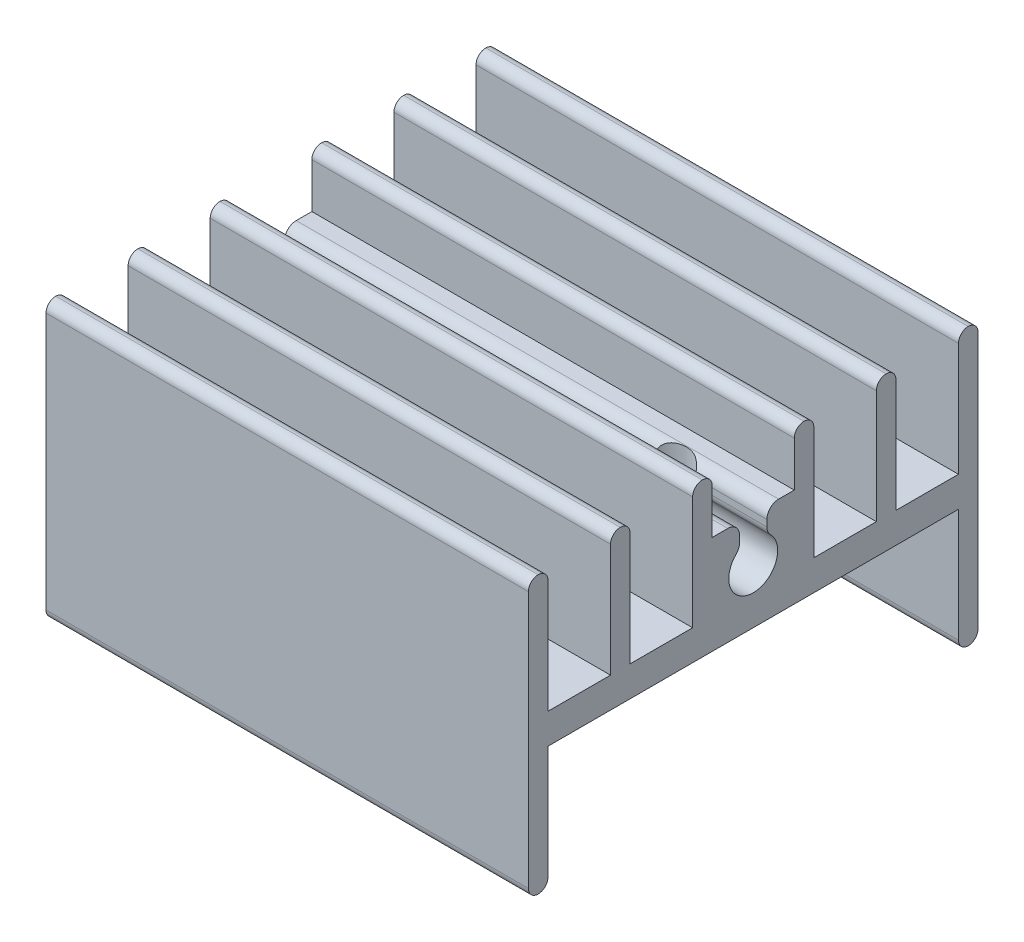
from build123d import *

# Parameters (mm, degrees)
SKETCH1_W                = 24.68
SKETCH1_H                = 23
BOSS_EXTRUDE1_DEPTH      = 1.55
BOSS_EXTRUDE2_DEPTH      = 6.3
BOSS_EXTRUDE2_DEPTH_BACK = 7.85
SKETCH2_W                = 24.68
SKETCH2_H                = 1
SKETCH3_W                = 24.68
SKETCH3_H                = 1
BOSS_EXTRUDE3_DEPTH      = 6.3
SKETCH4_W                = 24.68
SKETCH4_H                = 6.2
BOSS_EXTRUDE4_DEPTH      = 6.3
CUT_EXTRUDE1_DEPTH       = 29.336811747
FILLET1_R                = 0.5
FILLET2_R                = 0.6
SKETCH6_R                = 1.25
CUT_EXTRUDE2_DEPTH       = 10


with BuildPart() as part:
    # Sketch1 → Boss-Extrude1 (new body)
    with BuildSketch(Plane(origin=(0, 0, 0), x_dir=(1, 0, 0), z_dir=(0, 1, 0))):
        Rectangle(SKETCH1_W, SKETCH1_H)
    extrude(amount=BOSS_EXTRUDE1_DEPTH)

    # Sketch2 → Boss-Extrude2 (add, two sides: drawn at the far end of the back side and taken through both)
    with BuildSketch(Plane(origin=(0, 1.55, 0), x_dir=(1, 0, 0), z_dir=(0, 1, 0)).offset(-BOSS_EXTRUDE2_DEPTH_BACK)):
        with Locations((0, 11)):
            Rectangle(SKETCH2_W, SKETCH2_H)
        with Locations((0, -11)):
            Rectangle(SKETCH2_W, SKETCH2_H)
    extrude(amount=BOSS_EXTRUDE2_DEPTH + BOSS_EXTRUDE2_DEPTH_BACK)

    # Sketch3 → Boss-Extrude3 (add)
    with BuildSketch(Plane(origin=(0, 1.55, 0), x_dir=(1, 0, 0), z_dir=(0, 1, 0))):
        with Locations((0, 6.8)):
            Rectangle(SKETCH3_W, SKETCH3_H)
        with Locations((0, -6.8)):
            Rectangle(SKETCH3_W, SKETCH3_H)
    extrude(amount=BOSS_EXTRUDE3_DEPTH)

    # Sketch4 → Boss-Extrude4 (add)
    with BuildSketch(Plane(origin=(0, 1.55, 0), x_dir=(1, 0, 0), z_dir=(0, 1, 0))):
        Rectangle(SKETCH4_W, SKETCH4_H)
    extrude(amount=BOSS_EXTRUDE4_DEPTH)

    # Sketch5 → Cut-Extrude1 (cut, through all)
    with BuildSketch(Plane(origin=(12.34, 0, 0), x_dir=(0, 0, -1), z_dir=(1, 0, 0))):
        with BuildLine():
            Line((-2.1, 5.05), (-0.7, 5.05))
            Line((-0.7, 5.05), (-0.7, 3.835615759))
            ThreePointArc((-0.7, 3.835615759), (0, 1.55), (0.7, 3.835615759))
            Line((0.7, 3.835615759), (0.7, 5.05))
            Line((0.7, 5.05), (2.1, 5.05))
            Line((2.1, 5.05), (2.1, 8.15))
            Line((2.1, 8.15), (-2.1, 8.15))
            Line((-2.1, 8.15), (-2.1, 5.05))
        make_face()
    extrude(amount=-CUT_EXTRUDE1_DEPTH, mode=Mode.SUBTRACT)

    # Fillet1
    fillet1_edges = [part.edges().sort_by_distance(p)[0] for p in [
        (0, -6.3, -11.5),
        (0, -6.3, -10.5),
        (0, -6.3, 10.5),
        (0, -6.3, 11.5),
        (0, 7.85, -11.5),
        (0, 7.85, -10.5),
        (0, 7.85, -7.3),
        (0, 7.85, -6.3),
        (0, 7.85, -3.1),
        (0, 7.85, -2.1),
        (0, 7.85, 2.1),
        (0, 7.85, 3.1),
        (0, 7.85, 6.3),
        (0, 7.85, 7.3),
        (0, 7.85, 10.5),
        (0, 7.85, 11.5),
    ]]
    fillet(fillet1_edges, radius=FILLET1_R - 0.0001)  # a hair under: the kernel refuses the full size

    # Fillet2
    fillet2_edges = [part.edges().sort_by_distance(p)[0] for p in [
        (0, 3.835615759, -0.7),
        (0, 3.835615759, 0.7),
        (0, 5.05, 0.7),
        (0, 5.05, -0.7),
    ]]
    fillet(fillet2_edges, radius=FILLET2_R)

    # Sketch6 → Cut-Extrude2 (cut)
    with BuildSketch(Plane.XZ):
        with Locations(Location((7.67, 0, 0), (0, 0, 270))):
            Circle(SKETCH6_R)
    extrude(amount=-CUT_EXTRUDE2_DEPTH, mode=Mode.SUBTRACT)


solid = part.part
